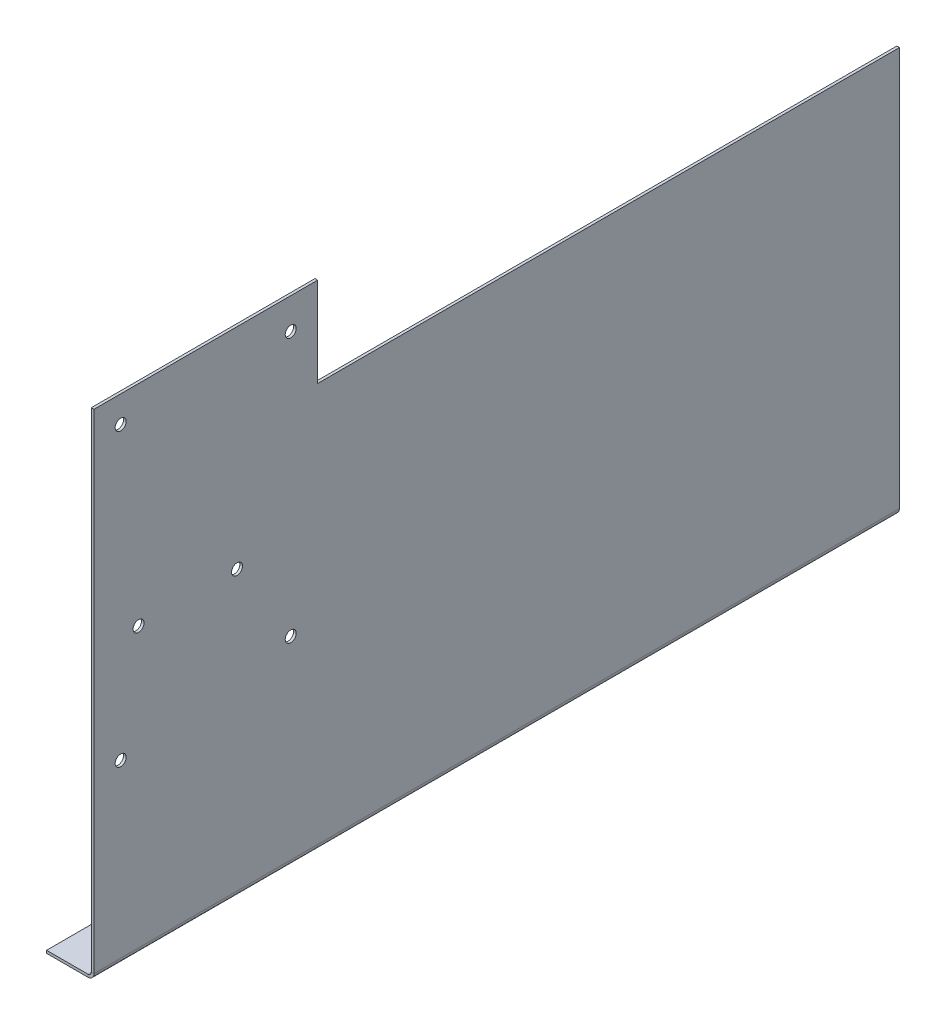
from build123d import *

# Parameters (mm, degrees)
BASE_FLANGE1_DEPTH = 228.6
CUT_EXTRUDE1_REACH = 270.245
SKETCH4_W          = 165.1
SKETCH4_H          = 25.4
CUT_EXTRUDE2_REACH = 270.245
SKETCH6_R          = 2
SKETCH7_R          = 1.5621
CUT_EXTRUDE3_DEPTH = 269.244677605


# Sheet-metal steps are written as plain solids
with BuildPart() as part:
    # Sketch1 → Base-Flange1 (new body)
    with BuildSketch(Plane.XY):
        with BuildLine():
            Line((0, 0), (11.7, 0))
            ThreePointArc((11.7, 0), (12.407106781, 0.292893219), (12.7, 1))
            Line((12.7, 1), (12.7, 139.7))
            Line((12.7, 139.7), (13.45946, 139.7))
            Line((13.45946, 139.7), (13.45946, 1))
            ThreePointArc((13.45946, 1), (12.944126097, -0.244126097), (11.7, -0.75946))
            Line((11.7, -0.75946), (0, -0.75946))
            Line((0, -0.75946), (0, 0))
        make_face()
    extrude(amount=BASE_FLANGE1_DEPTH)

    # Sketch4 → Cut-Extrude1 (cut, up to next)
    with BuildSketch(Plane(origin=(13.45946, 0, 0), x_dir=(0, 0, -1), z_dir=(1, 0, 0)), mode=Mode.PRIVATE) as cut_extrude1_sk1:
        with Locations((-82.55, 127)):
            Rectangle(SKETCH4_W, SKETCH4_H)
    cut_extrude1_tool1 = extrude(cut_extrude1_sk1.sketch, amount=-CUT_EXTRUDE1_REACH, mode=Mode.PRIVATE) & part.part
    add(cut_extrude1_tool1.solids().sort_by_distance((13.45946, 127, 82.55))[0], mode=Mode.SUBTRACT)

    # Sketch6 → Cut-Extrude2 (cut, up to next)
    with BuildSketch(Plane(origin=(0, 0, 0), x_dir=(1, 0, 0), z_dir=(0, 1, 0)), mode=Mode.PRIVATE) as cut_extrude2_sk1:
        with Locations(Location((6.35, -12.7, 0), (0, 0, 270))):
            Circle(SKETCH6_R)
    cut_extrude2_tool1 = extrude(cut_extrude2_sk1.sketch, amount=-CUT_EXTRUDE2_REACH, mode=Mode.PRIVATE) & part.part
    # Sketch6 → Cut-Extrude2 (cut, up to next)
    with BuildSketch(Plane(origin=(0, 0, 0), x_dir=(1, 0, 0), z_dir=(0, 1, 0)), mode=Mode.PRIVATE) as cut_extrude2_sk2:
        with Locations(Location((6.35, -215.9, 0), (0, 0, 270))):
            Circle(SKETCH6_R)
    cut_extrude2_tool2 = extrude(cut_extrude2_sk2.sketch, amount=-CUT_EXTRUDE2_REACH, mode=Mode.PRIVATE) & part.part
    add(cut_extrude2_tool1.solids().sort_by_distance((6.35, 0, 12.7))[0], mode=Mode.SUBTRACT)
    add(cut_extrude2_tool2.solids().sort_by_distance((6.35, 0, 215.9))[0], mode=Mode.SUBTRACT)

    # Sketch7 → Cut-Extrude3 (cut, through all)
    with BuildSketch(Plane(origin=(13.45946, 0, 0), x_dir=(0, 0, -1), z_dir=(1, 0, 0))):
        with Locations((-221.0181, 49.61814)):
            Circle(SKETCH7_R)
        with Locations((-172.7581, 55.96814)):
            Circle(SKETCH7_R)
        with Locations((-215.9381, 80.09814)):
            Circle(SKETCH7_R)
        with Locations((-187.9981, 80.09814)):
            Circle(SKETCH7_R)
        with Locations((-221.0181, 132.16814)):
            Circle(SKETCH7_R)
        with Locations((-172.7581, 130.89814)):
            Circle(SKETCH7_R)
    extrude(amount=-CUT_EXTRUDE3_DEPTH, mode=Mode.SUBTRACT)


solid = part.part
